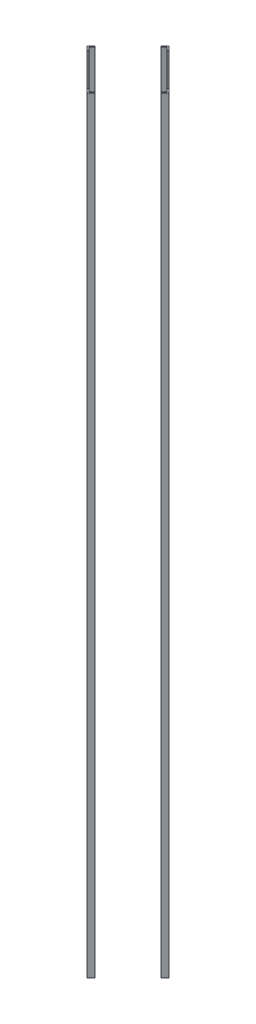
from build123d import *

# Parameters (mm, degrees)
BOSS_EXTRUDE1_DEPTH   = 1778
BOSS_EXTRUDE1_2_DEPTH = 1778
BOSS_EXTRUDE1_3_DEPTH = 1778
BOSS_EXTRUDE1_4_DEPTH = 1778


with BuildPart() as part:
    # Sketch2 → Boss-Extrude1 (new body)
    with BuildSketch(Plane(origin=(0, 0, 0), x_dir=(1, 0, 0), z_dir=(0, 1, 0))):
        Polygon((0, 94.77428536), (-8.980256121, 85.794029239), (-6.735192091, 83.548965209), (0, 90.2841573), (6.735192091, 83.548965209), (8.980256121, 85.794029239), align=None)
    extrude(amount=BOSS_EXTRUDE1_DEPTH)


with BuildPart() as body_2:
    # Sketch2 → Boss-Extrude1 2 (new body)
    with BuildSketch(Plane(origin=(0, 0, 0), x_dir=(1, 0, 0), z_dir=(0, 1, 0))):
        Polygon((94.741702077, 0.032583283), (85.761445956, 9.012839404), (83.516381926, 6.767775374), (90.251574017, 0.032583283), (83.516381926, -6.702608808), (85.761445956, -8.947672838), align=None)
    extrude(amount=BOSS_EXTRUDE1_2_DEPTH)


with BuildPart() as body_3:
    # Sketch2 → Boss-Extrude1 3 (new body)
    with BuildSketch(Plane(origin=(0, 0, 0), x_dir=(1, 0, 0), z_dir=(0, 1, 0))):
        Polygon((0, -94.709118794), (8.980256121, -85.728862673), (6.735192091, -83.483798643), (0, -90.218990734), (-6.735192091, -83.483798643), (-8.980256121, -85.728862673), align=None)
    extrude(amount=BOSS_EXTRUDE1_3_DEPTH)


with BuildPart() as body_4:
    # Sketch2 → Boss-Extrude1 4 (new body)
    with BuildSketch(Plane(origin=(0, 0, 0), x_dir=(1, 0, 0), z_dir=(0, 1, 0))):
        Polygon((-94.741702077, 0.032583283), (-85.761445956, -8.947672838), (-83.516381926, -6.702608808), (-90.251574017, 0.032583283), (-83.516381926, 6.767775374), (-85.761445956, 9.012839404), align=None)
    extrude(amount=BOSS_EXTRUDE1_4_DEPTH)


solid = Compound([part.part, body_2.part, body_3.part, body_4.part])
